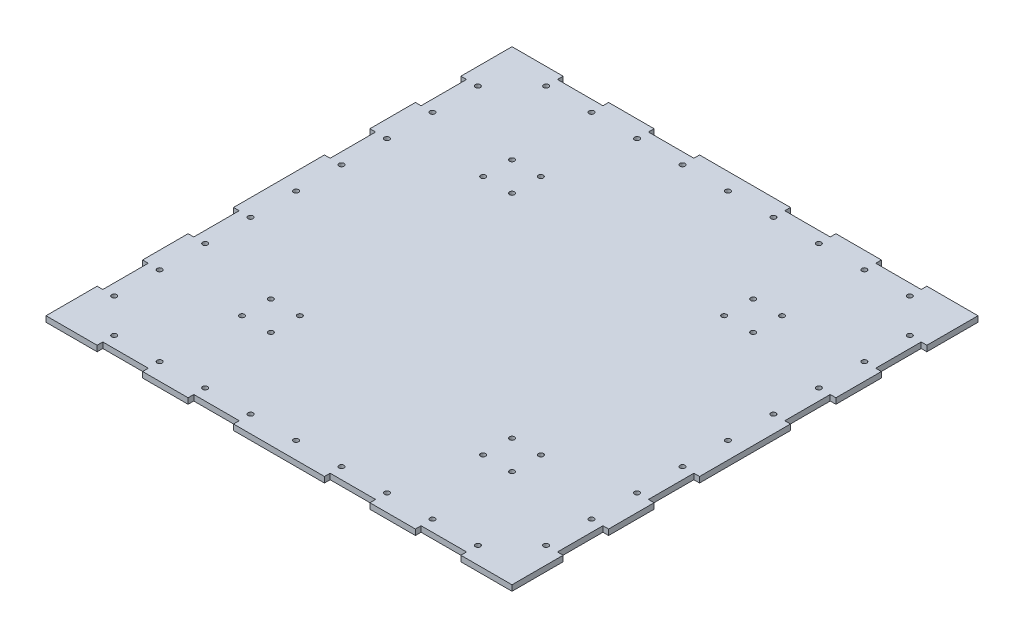
from build123d import *

# Parameters (mm, degrees)
SKETCH_1_R          = 2.2
EXTRUDE_1_DEPTH     = 5
SKETCH_2_R          = 2.2
CUT_EXTRUDE_1_DEPTH = 10


with BuildPart() as part:
    # 草图1 → 凸台-拉伸1 (new body)
    with BuildSketch(Plane(origin=(0, 0, 0), x_dir=(1, 0, 0), z_dir=(0, 1, 0))):
        Polygon((80, 200), (40, 200), (40, 205), (-40, 205), (-40, 200), (-80, 200), (-80, 205), (-120, 205), (-120, 200), (-160, 200), (-160, 205), (-200, 205), (-205, 205), (-205, 200), (-205, 160), (-200, 160), (-200, 120), (-205, 120), (-205, 80), (-200, 80), (-200, 40), (-205, 40), (-205, -40), (-200, -40), (-200, -80), (-205, -80), (-205, -120), (-200, -120), (-200, -160), (-205, -160), (-205, -200), (-205, -205), (-200, -205), (-160, -205), (-160, -200), (-120, -200), (-120, -205), (-80, -205), (-80, -200), (-40, -200), (-40, -205), (40, -205), (40, -200), (80, -200), (80, -205), (120, -205), (120, -200), (160, -200), (160, -205), (200, -205), (205, -205), (205, -200), (205, -160), (200, -160), (200, -120), (205, -120), (205, -80), (200, -80), (200, -40), (205, -40), (205, 40), (200, 40), (200, 80), (205, 80), (205, 120), (200, 120), (200, 160), (205, 160), (205, 200), (205, 205), (200, 205), (160, 205), (160, 200), (120, 200), (120, 205), (80, 205), align=None)
        with Locations((-160, -190)):
            Circle(SKETCH_1_R, mode=Mode.SUBTRACT)
        with Locations((-190, -160)):
            Circle(SKETCH_1_R, mode=Mode.SUBTRACT)
        with Locations((-120, -190)):
            Circle(SKETCH_1_R, mode=Mode.SUBTRACT)
        with Locations((-190, -120)):
            Circle(SKETCH_1_R, mode=Mode.SUBTRACT)
        with Locations((-80, -190)):
            Circle(SKETCH_1_R, mode=Mode.SUBTRACT)
        with Locations((-40, -190)):
            Circle(SKETCH_1_R, mode=Mode.SUBTRACT)
        with Locations((0, -190)):
            Circle(SKETCH_1_R, mode=Mode.SUBTRACT)
        with Locations((-190, -80)):
            Circle(SKETCH_1_R, mode=Mode.SUBTRACT)
        with Locations((-190, -40)):
            Circle(SKETCH_1_R, mode=Mode.SUBTRACT)
        with Locations((40, -190)):
            Circle(SKETCH_1_R, mode=Mode.SUBTRACT)
        with Locations((80, -190)):
            Circle(SKETCH_1_R, mode=Mode.SUBTRACT)
        with Locations((120, -190)):
            Circle(SKETCH_1_R, mode=Mode.SUBTRACT)
        with Locations((160, -190)):
            Circle(SKETCH_1_R, mode=Mode.SUBTRACT)
        with Locations((190, -160)):
            Circle(SKETCH_1_R, mode=Mode.SUBTRACT)
        with Locations((190, -120)):
            Circle(SKETCH_1_R, mode=Mode.SUBTRACT)
        with Locations((190, -80)):
            Circle(SKETCH_1_R, mode=Mode.SUBTRACT)
        with Locations((190, -40)):
            Circle(SKETCH_1_R, mode=Mode.SUBTRACT)
        with Locations((190, 0)):
            Circle(SKETCH_1_R, mode=Mode.SUBTRACT)
        with Locations((-190, 0)):
            Circle(SKETCH_1_R, mode=Mode.SUBTRACT)
        with Locations((-190, 40)):
            Circle(SKETCH_1_R, mode=Mode.SUBTRACT)
        with Locations((-190, 80)):
            Circle(SKETCH_1_R, mode=Mode.SUBTRACT)
        with Locations((-190, 120)):
            Circle(SKETCH_1_R, mode=Mode.SUBTRACT)
        with Locations((-190, 160)):
            Circle(SKETCH_1_R, mode=Mode.SUBTRACT)
        with Locations((-160, 190)):
            Circle(SKETCH_1_R, mode=Mode.SUBTRACT)
        with Locations((-120, 190)):
            Circle(SKETCH_1_R, mode=Mode.SUBTRACT)
        with Locations((-80, 190)):
            Circle(SKETCH_1_R, mode=Mode.SUBTRACT)
        with Locations((-40, 190)):
            Circle(SKETCH_1_R, mode=Mode.SUBTRACT)
        with Locations((190, 40)):
            Circle(SKETCH_1_R, mode=Mode.SUBTRACT)
        with Locations((190, 80)):
            Circle(SKETCH_1_R, mode=Mode.SUBTRACT)
        with Locations((0, 190)):
            Circle(SKETCH_1_R, mode=Mode.SUBTRACT)
        with Locations((40, 190)):
            Circle(SKETCH_1_R, mode=Mode.SUBTRACT)
        with Locations((80, 190)):
            Circle(SKETCH_1_R, mode=Mode.SUBTRACT)
        with Locations((190, 120)):
            Circle(SKETCH_1_R, mode=Mode.SUBTRACT)
        with Locations((120, 190)):
            Circle(SKETCH_1_R, mode=Mode.SUBTRACT)
        with Locations((190, 160)):
            Circle(SKETCH_1_R, mode=Mode.SUBTRACT)
        with Locations((160, 190)):
            Circle(SKETCH_1_R, mode=Mode.SUBTRACT)
    extrude(amount=EXTRUDE_1_DEPTH)

    # 草图2 → 切除-拉伸1 (cut)
    with BuildSketch(Plane(origin=(0, 5, 0), x_dir=(1, 0, 0), z_dir=(0, 1, 0))):
        with Locations((-118.793939239, 118.793939239)):
            Circle(SKETCH_2_R)
        with Locations((-93.338095117, 118.793939239)):
            Circle(SKETCH_2_R)
        with Locations((-93.338095117, 93.338095117)):
            Circle(SKETCH_2_R)
        with Locations((-118.793939239, 93.338095117)):
            Circle(SKETCH_2_R)
        with Locations((118.793939239, 118.793939239)):
            Circle(SKETCH_2_R)
        with Locations((118.793939239, 93.338095117)):
            Circle(SKETCH_2_R)
        with Locations((93.338095117, 93.338095117)):
            Circle(SKETCH_2_R)
        with Locations((93.338095117, 118.793939239)):
            Circle(SKETCH_2_R)
        with Locations((118.793939239, -118.793939239)):
            Circle(SKETCH_2_R)
        with Locations((93.338095117, -118.793939239)):
            Circle(SKETCH_2_R)
        with Locations((93.338095117, -93.338095117)):
            Circle(SKETCH_2_R)
        with Locations((118.793939239, -93.338095117)):
            Circle(SKETCH_2_R)
        with Locations((-118.793939239, -118.793939239)):
            Circle(SKETCH_2_R)
        with Locations((-118.793939239, -93.338095117)):
            Circle(SKETCH_2_R)
        with Locations((-93.338095117, -93.338095117)):
            Circle(SKETCH_2_R)
        with Locations((-93.338095117, -118.793939239)):
            Circle(SKETCH_2_R)
    extrude(amount=-CUT_EXTRUDE_1_DEPTH, mode=Mode.SUBTRACT)


solid = part.part
